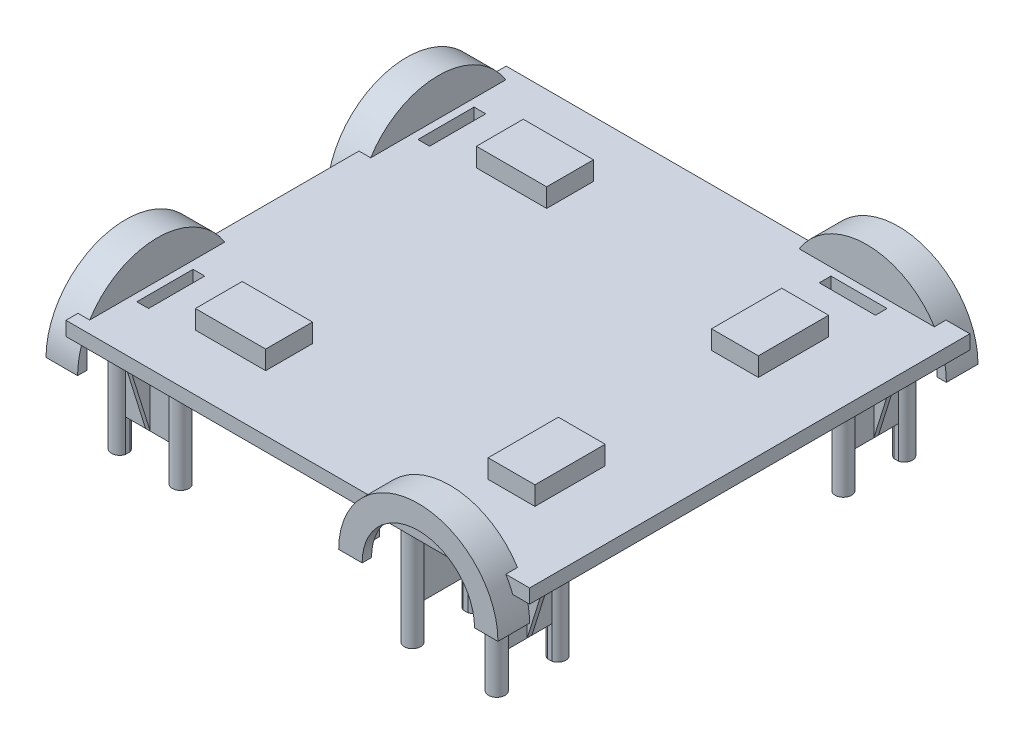
from build123d import *

# Parameters (mm, degrees)
SKETCH1_W            = 99
SKETCH1_H            = 47
SKETCH1_W_2          = 2.5
SKETCH1_H_2          = 12
SKETCH1_W_3          = 12
SKETCH1_H_3          = 2.5
BOSS_EXTRUDE1_DEPTH  = 3
R_VOLUTION1_START    = -4.25
R_VOLUTION1_DEPTH    = 6.75
R_VOLUTION1_START_2  = 0.5
R_VOLUTION1_2_DEPTH  = 2
R_VOLUTION1_3_DEPTH  = 2
SKETCH9_W            = 13.604173072
SKETCH9_H            = 30
CUT_EXTRUDE2_DEPTH   = 6
CUT_EXTRUDE8_DEPTH   = 0.5
BOSS_EXTRUDE2_DEPTH  = 23
SKETCH10_R           = 1
CUT_EXTRUDE3_DEPTH   = 10
REVOLVE1_START       = 9
REVOLVE1_OUTLINE_W   = 2
REVOLVE1_OUTLINE_H   = 6
REVOLVE1_DEPTH       = 6
REVOLVE1_START_2     = -15
REVOLVE1_2_OUTLINE_W = 2
REVOLVE1_2_OUTLINE_H = 6
REVOLVE1_2_DEPTH     = 5.999999899
REVOLVE1_START_3     = 5.5
REVOLVE1_3_DEPTH     = 6.75
REVOLVE1_START_4     = 10.25
REVOLVE1_4_DEPTH     = 2
REVOLVE1_5_DEPTH     = 2
CUT_EXTRUDE12_DEPTH  = 6
CUT_EXTRUDE13_DEPTH  = 6
BOSS_EXTRUDE3_DEPTH  = 16
CUT_EXTRUDE15_DEPTH  = 1
CUT_EXTRUDE16_DEPTH  = 1
SKETCH26_W           = 10
SKETCH26_H           = 15
SKETCH26_W_2         = 6
SKETCH26_H_2         = 11
SKETCH26_W_3         = 15
SKETCH26_H_3         = 10
SKETCH26_W_4         = 11
SKETCH26_H_4         = 6
BOSS_EXTRUDE4_DEPTH  = 7
SKETCH26_3_W         = 6
SKETCH26_3_H         = 11
SKETCH26_3_W_2       = 11
SKETCH26_3_H_2       = 6
CUT_EXTRUDE17_DEPTH  = 3


with BuildPart() as part:
    # Sketch1 → Boss-Extrude1 (new body)
    with BuildSketch(Plane(origin=(0, 0, 0), x_dir=(1, 0, 0), z_dir=(0, 1, 0))):
        with Locations((49.5, 15.5)):
            Rectangle(SKETCH1_W, SKETCH1_H)
        with Locations((5.4, 9)):
            Rectangle(SKETCH1_W_2, SKETCH1_H_2, mode=Mode.SUBTRACT)
        with Locations((79.5, -2.6)):
            Rectangle(SKETCH1_W_3, SKETCH1_H_3, mode=Mode.SUBTRACT)
    boss_extrude1 = extrude(amount=BOSS_EXTRUDE1_DEPTH)

    # Révolution1: read off the stored shape, not the designer's step
    # Révolution1 outline → Révolution1 (add)
    with BuildSketch(Plane.YZ.offset(R_VOLUTION1_START)):
        with BuildLine():
            Line((-6, 8), (-6, 6))
            ThreePointArc((-6, 6), (9, -9), (-6, -24))
            Line((-6, -24), (-6, -26))
            ThreePointArc((-6, -26), (11, -9), (-6, 8))
        make_face()
    r_volution1 = extrude(amount=R_VOLUTION1_DEPTH)

    # R_volution1 2 outline → R_volution1 2 (add)
    with BuildSketch(Plane.YZ.offset(R_VOLUTION1_START_2)):
        with BuildLine():
            ThreePointArc((-6, 0), (-2.788601192, -0.592448769), (0, -2.291796068))
            Line((0, -2.291796068), (0, 4.747727085))
            ThreePointArc((0, 4.747727085), (-2.935355345, 5.683594694), (-6, 6))
            Line((-6, 6), (-6, 0))
        make_face()
        with BuildLine():
            ThreePointArc((0, -15.708203932), (-2.788601192, -17.407551231), (-6, -18))
            Line((-6, -18), (-6, -24))
            ThreePointArc((-6, -24), (-2.935355345, -23.683594694), (0, -22.747727085))
            Line((0, -22.747727085), (0, -15.708203932))
        make_face()
        with BuildLine():
            Line((3, 3), (3, -21))
            ThreePointArc((3, -21), (9, -9), (3, 3))
        make_face()
    r_volution1_2 = extrude(amount=R_VOLUTION1_2_DEPTH)

    # R_volution1 3 outline → R_volution1 3 (add)
    with BuildSketch(Plane.YZ.offset(R_VOLUTION1_START)):
        with BuildLine():
            Line((-6, 6), (-6, 3))
            ThreePointArc((-6, 3), (6, -9), (-6, -21))
            Line((-6, -21), (-6, -24))
            ThreePointArc((-6, -24), (9, -9), (-6, 6))
        make_face()
    r_volution1_3 = extrude(amount=R_VOLUTION1_3_DEPTH)

    # Sketch9 → Cut-Extrude2 (cut)
    with BuildSketch(Plane(origin=(0, -6, 0), x_dir=(-1, 0, 0), z_dir=(0, -1, 0))):
        with Locations((-4.552086536, 9)):
            Rectangle(SKETCH9_W, SKETCH9_H)
    cut_extrude2 = extrude(amount=-CUT_EXTRUDE2_DEPTH, mode=Mode.SUBTRACT)

    # Cut-Extrude8: read off the stored shape, not the designer's step
    # Cut-Extrude8 outline → Cut-Extrude8 (cut)
    with BuildSketch(Plane.YZ):
        with BuildLine():
            Line((0, 4.747727085), (0, -22.747727085))
            ThreePointArc((0, -22.747727085), (1.550737546, -21.960955309), (3, -21))
            Line((3, -21), (3, 3))
            ThreePointArc((3, 3), (1.550737546, 3.960955309), (0, 4.747727085))
        make_face()
    extrude(amount=CUT_EXTRUDE8_DEPTH, mode=Mode.SUBTRACT)

    # Sketch1<9> → Boss-Extrude2 (add)
    with BuildSketch(Plane(origin=(0, 0, 0), x_dir=(1, 0, 0), z_dir=(0, 1, 0))):
        with BuildLine():
            ThreePointArc((5.177050983, 18.5), (1.75, 18), (5.177050983, 17.5))
            Line((5.177050983, 17.5), (5.177050983, 18.5))
        make_face()
        with BuildLine():
            ThreePointArc((5.177050983, 0.5), (1.75, 0), (5.177050983, -0.5))
            Line((5.177050983, -0.5), (5.177050983, 0.5))
        make_face()
        with BuildLine():
            ThreePointArc((14.822949017, 17.5), (18.25, 18), (14.822949017, 18.5))
            Line((14.822949017, 18.5), (14.822949017, 17.5))
        make_face()
        with BuildLine():
            ThreePointArc((14.822949017, -0.5), (18.25, 0), (14.822949017, 0.5))
            Line((14.822949017, 0.5), (14.822949017, -0.5))
        make_face()
        with BuildLine():
            Line((71, -2.822949017), (70, -2.822949017))
            ThreePointArc((70, -2.822949017), (70.5, -6.25), (71, -2.822949017))
        make_face()
        with BuildLine():
            Line((70, 6.822949017), (71, 6.822949017))
            ThreePointArc((71, 6.822949017), (70.5, 10.25), (70, 6.822949017))
        make_face()
        with BuildLine():
            ThreePointArc((88, -2.822949017), (88.5, -6.25), (89, -2.822949017))
            Line((89, -2.822949017), (88, -2.822949017))
        make_face()
        with BuildLine():
            ThreePointArc((89, 6.822949017), (88.5, 10.25), (88, 6.822949017))
            Line((88, 6.822949017), (89, 6.822949017))
        make_face()
    boss_extrude2 = extrude(amount=-BOSS_EXTRUDE2_DEPTH)

    # Sketch10 → Cut-Extrude3 (cut)
    with BuildSketch(Plane(origin=(0, -23, 0), x_dir=(-1, 0, 0), z_dir=(0, -1, 0))):
        with Locations(Location((-70.5, -4.5, 0), (0, 0, 90))):
            Circle(SKETCH10_R)
        with Locations(Location((-70.5, 8.5, 0), (0, 0, 90))):
            Circle(SKETCH10_R)
        with Locations(Location((-88.5, 8.5, 0), (0, 0, 90))):
            Circle(SKETCH10_R)
        with Locations(Location((-88.5, -4.5, 0), (0, 0, 90))):
            Circle(SKETCH10_R)
        with Locations(Location((-16.5, 18, 0), (0, 0, 90))):
            Circle(SKETCH10_R)
        with Locations(Location((-16.5, 0, 0), (0, 0, 90))):
            Circle(SKETCH10_R)
        with Locations(Location((-3.5, 0, 0), (0, 0, 90))):
            Circle(SKETCH10_R)
        with Locations(Location((-3.5, 18, 0), (0, 0, 90))):
            Circle(SKETCH10_R)
    cut_extrude3 = extrude(amount=-CUT_EXTRUDE3_DEPTH, mode=Mode.SUBTRACT)

    # Revolve1: read off the stored shape, not the designer's step
    # Revolve1 outline → Revolve1 (add)
    with BuildSketch(Plane.ZY.offset(-79.5).offset(REVOLVE1_START)):
        with Locations((6.5, -3)):
            Rectangle(REVOLVE1_OUTLINE_W, REVOLVE1_OUTLINE_H)
    revolve1 = extrude(amount=REVOLVE1_DEPTH)

    # Revolve1 2 outline → Revolve1 2 (add)
    with BuildSketch(Plane.ZY.offset(-79.5).offset(REVOLVE1_START_2)):
        with Locations((6.5, -3)):
            Rectangle(REVOLVE1_2_OUTLINE_W, REVOLVE1_2_OUTLINE_H)
    revolve1_2 = extrude(amount=REVOLVE1_2_DEPTH)

    # Revolve1 3 outline → Revolve1 3 (add)
    with BuildSketch(Plane.XY.offset(REVOLVE1_START_3)):
        with BuildLine():
            Line((62.5, -6), (64.5, -6))
            ThreePointArc((64.5, -6), (79.5, 9), (94.5, -6))
            Line((94.5, -6), (96.5, -6))
            ThreePointArc((96.5, -6), (79.5, 11), (62.5, -6))
        make_face()
    revolve1_3 = extrude(amount=REVOLVE1_3_DEPTH)

    # Revolve1 4 outline → Revolve1 4 (add)
    with BuildSketch(Plane.XY.offset(REVOLVE1_START_4)):
        with BuildLine():
            Line((64.5, -6), (67.5, -6))
            ThreePointArc((67.5, -6), (79.5, 6), (91.5, -6))
            Line((91.5, -6), (94.5, -6))
            ThreePointArc((94.5, -6), (79.5, 9), (64.5, -6))
        make_face()
    revolve1_4 = extrude(amount=REVOLVE1_4_DEPTH)

    # Revolve1 5 outline → Revolve1 5 (add)
    with BuildSketch(Plane.XY.offset(REVOLVE1_START_3)):
        with BuildLine():
            Line((70.5, 0), (70.5, -6))
            ThreePointArc((70.5, -6), (71.092448769, -2.788601192), (72.791796068, 0))
            Line((72.791796068, 0), (70.5, 0))
        make_face()
        with BuildLine():
            ThreePointArc((91.5, 3), (79.5, 9), (67.5, 3))
            Line((67.5, 3), (91.5, 3))
        make_face()
        with BuildLine():
            Line((88.500000101, 0), (86.208203932, 0))
            ThreePointArc((86.208203932, 0), (87.907551231, -2.788601192), (88.5, -6))
            Line((88.5, -6), (88.500000101, 0))
        make_face()
    revolve1_5 = extrude(amount=REVOLVE1_5_DEPTH)

    # Sketch20 → Cut-Extrude12 (cut)
    with BuildSketch(Plane(origin=(0, 0, 0), x_dir=(-1, 0, 0), z_dir=(0, -1, 0))):
        with BuildLine():
            Line((-94.5, -5.5), (-94.5, -8))
            Line((-94.5, -8), (-93.247727085, -8))
            Line((-93.247727085, -8), (-93.247727085, -7.5))
            Line((-93.247727085, -7.5), (-86.208203932, -7.5))
            Line((-86.208203932, -7.5), (-86.208203932, -5.5))
            Line((-86.208203932, -5.5), (-87.063859338, -5.5))
            ThreePointArc((-87.063859338, -5.5), (-88.5, -6.25), (-89.936140662, -5.5))
            Line((-89.936140662, -5.5), (-94.5, -5.5))
        make_face()
        with BuildLine():
            Line((-72.791796068, -7.5), (-65.752272915, -7.5))
            Line((-65.752272915, -7.5), (-65.752272915, -8))
            Line((-65.752272915, -8), (-64.5, -8))
            Line((-64.5, -8), (-64.5, -5.5))
            Line((-64.5, -5.5), (-69.063859338, -5.5))
            ThreePointArc((-69.063859338, -5.5), (-70.5, -6.25), (-71.936140662, -5.5))
            Line((-71.936140662, -5.5), (-72.791796068, -5.5))
            Line((-72.791796068, -5.5), (-72.791796068, -7.5))
        make_face()
    cut_extrude12 = extrude(amount=CUT_EXTRUDE12_DEPTH, mode=Mode.SUBTRACT)

    # Sketch20<3> → Cut-Extrude13 (cut)
    with BuildSketch(Plane(origin=(0, 0, 0), x_dir=(-1, 0, 0), z_dir=(0, -1, 0))):
        Polygon((-93.247727085, -8), (-94.5, -8), (-94.5, -10.25), (-72, -10.25), (-72, -8), align=None)
    extrude(amount=CUT_EXTRUDE13_DEPTH, mode=Mode.SUBTRACT)

    # Sketch23 → Boss-Extrude3 (add)
    with BuildSketch(Plane(origin=(0, 0, 0), x_dir=(-1, 0, 0), z_dir=(0, -1, 0))):
        Polygon((-89, 1.5), (-89, -2.822949017), (-88, -2.822949017), (-88, 6.822949017), (-89, 6.822949017), (-89, 2.5), (-94, 2.5), (-94, 1.5), align=None)
        Polygon((-71, -2.822949017), (-70, -2.822949017), (-70, 1.5), (-65, 1.5), (-65, 2.5), (-70, 2.5), (-70, 6.822949017), (-71, 6.822949017), align=None)
        Polygon((-14.822949017, 0.5), (-14.822949017, -0.5), (-10.5, -0.5), (-10.5, -5.5), (-9.5, -5.5), (-9.5, -0.5), (-5.177050983, -0.5), (-5.177050983, 0.5), align=None)
        Polygon((-10.5, 18.5), (-14.822949017, 18.5), (-14.822949017, 17.5), (-5.177050983, 17.5), (-5.177050983, 18.5), (-9.5, 18.5), (-9.5, 22.5), (-10.5, 22.5), align=None)
    boss_extrude3 = extrude(amount=BOSS_EXTRUDE3_DEPTH)

    # Sketch24 → Cut-Extrude15 (cut)
    with BuildSketch(Plane.ZY.offset(-9.5)):
        Polygon((-18.5, -16), (-22.6, 0), (-22.6, -16), align=None)
        Polygon((5.5, 0), (5.5, -16), (0.5, -16), align=None)
    cut_extrude15 = extrude(amount=-CUT_EXTRUDE15_DEPTH, mode=Mode.SUBTRACT)

    # Sketch25 → Cut-Extrude16 (cut)
    with BuildSketch(Plane.XY.offset(-1.5)):
        Polygon((94, 0), (89, -16), (94, -16), align=None)
        Polygon((69.5, -16), (64.5, 0), (64.5, -16), align=None)
    cut_extrude16 = extrude(amount=-CUT_EXTRUDE16_DEPTH, mode=Mode.SUBTRACT)

    # Sketch26 → Boss-Extrude4 (add)
    # profile 1 of 4: a face of its own
    with BuildSketch(Plane(origin=(0, 0, 0), x_dir=(-1, 0, 0), z_dir=(0, -1, 0))):
        with Locations((-79.5, 15.15)):
            Rectangle(SKETCH26_W, SKETCH26_H)
        with Locations((-79.5, 15.15)):
            Rectangle(SKETCH26_W_2, SKETCH26_H_2, mode=Mode.SUBTRACT)
    # profile 2 of 4: a face of its own
    with BuildSketch(Plane(origin=(0, 0, 0), x_dir=(-1, 0, 0), z_dir=(0, -1, 0))):
        with Locations((-79.5, 15.15)):
            Rectangle(SKETCH26_W_2, SKETCH26_H_2)
    # profile 3 of 4: a face of its own
    with BuildSketch(Plane(origin=(0, 0, 0), x_dir=(-1, 0, 0), z_dir=(0, -1, 0))):
        with Locations((-23.15, 9)):
            Rectangle(SKETCH26_W_3, SKETCH26_H_3)
        with Locations((-23.15, 9)):
            Rectangle(SKETCH26_W_4, SKETCH26_H_4, mode=Mode.SUBTRACT)
    # profile 4 of 4: a face of its own
    with BuildSketch(Plane(origin=(0, 0, 0), x_dir=(-1, 0, 0), z_dir=(0, -1, 0))):
        with Locations((-23.15, 9)):
            Rectangle(SKETCH26_W_4, SKETCH26_H_4)
    boss_extrude4 = extrude(amount=-BOSS_EXTRUDE4_DEPTH)

    # Sketch26<3> → Cut-Extrude17 (cut)
    with BuildSketch(Plane(origin=(0, 0, 0), x_dir=(-1, 0, 0), z_dir=(0, -1, 0))):
        with Locations((-79.5, 15.15)):
            Rectangle(SKETCH26_3_W, SKETCH26_3_H)
        with Locations((-23.15, 9)):
            Rectangle(SKETCH26_3_W_2, SKETCH26_3_H_2)
    cut_extrude17 = extrude(amount=-CUT_EXTRUDE17_DEPTH, mode=Mode.SUBTRACT)

    # Mirror3: Boss-Extrude1, Révolution1, R_volution1 2, R_volution1 3, Cut-Extrude2, Boss-Extrude2, Cut-Extrude3, Revolve1, Revolve1 2, Revolve1 3, Revolve1 4, Revolve1 5, Cut-Extrude12, Boss-Extrude3, Cut-Extrude15, Cut-Extrude16, Boss-Extrude4, Cut-Extrude17 across plane
    add(boss_extrude1.mirror(Plane(origin=(0, 3, -39), x_dir=(1, 0, 0), z_dir=(0, 0, -1))))
    add(r_volution1.mirror(Plane(origin=(0, 3, -39), x_dir=(1, 0, 0), z_dir=(0, 0, -1))))
    add(r_volution1_2.mirror(Plane(origin=(0, 3, -39), x_dir=(1, 0, 0), z_dir=(0, 0, -1))))
    add(r_volution1_3.mirror(Plane(origin=(0, 3, -39), x_dir=(1, 0, 0), z_dir=(0, 0, -1))))
    add(cut_extrude2.mirror(Plane(origin=(0, 3, -39), x_dir=(1, 0, 0), z_dir=(0, 0, -1))), mode=Mode.SUBTRACT)
    add(boss_extrude2.mirror(Plane(origin=(0, 3, -39), x_dir=(1, 0, 0), z_dir=(0, 0, -1))))
    add(cut_extrude3.mirror(Plane(origin=(0, 3, -39), x_dir=(1, 0, 0), z_dir=(0, 0, -1))), mode=Mode.SUBTRACT)
    add(revolve1.mirror(Plane(origin=(0, 3, -39), x_dir=(1, 0, 0), z_dir=(0, 0, -1))))
    add(revolve1_2.mirror(Plane(origin=(0, 3, -39), x_dir=(1, 0, 0), z_dir=(0, 0, -1))))
    add(revolve1_3.mirror(Plane(origin=(0, 3, -39), x_dir=(1, 0, 0), z_dir=(0, 0, -1))))
    add(revolve1_4.mirror(Plane(origin=(0, 3, -39), x_dir=(1, 0, 0), z_dir=(0, 0, -1))))
    add(revolve1_5.mirror(Plane(origin=(0, 3, -39), x_dir=(1, 0, 0), z_dir=(0, 0, -1))))
    add(cut_extrude12.mirror(Plane(origin=(0, 3, -39), x_dir=(1, 0, 0), z_dir=(0, 0, -1))), mode=Mode.SUBTRACT)
    add(boss_extrude3.mirror(Plane(origin=(0, 3, -39), x_dir=(1, 0, 0), z_dir=(0, 0, -1))))
    add(cut_extrude15.mirror(Plane(origin=(0, 3, -39), x_dir=(1, 0, 0), z_dir=(0, 0, -1))), mode=Mode.SUBTRACT)
    add(cut_extrude16.mirror(Plane(origin=(0, 3, -39), x_dir=(1, 0, 0), z_dir=(0, 0, -1))), mode=Mode.SUBTRACT)
    add(boss_extrude4.mirror(Plane(origin=(0, 3, -39), x_dir=(1, 0, 0), z_dir=(0, 0, -1))))
    add(cut_extrude17.mirror(Plane(origin=(0, 3, -39), x_dir=(1, 0, 0), z_dir=(0, 0, -1))), mode=Mode.SUBTRACT)


solid = part.part
